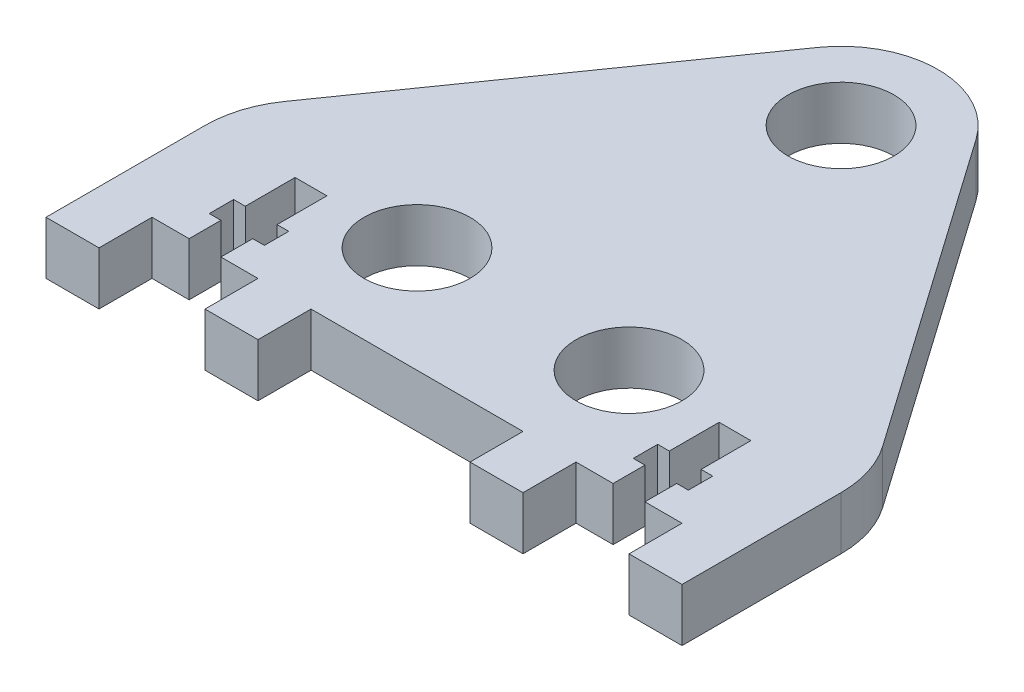
from build123d import *

# Parameters (mm, degrees)
SKETCH1_R           = 5
BOSS_EXTRUDE1_DEPTH = 5


with BuildPart() as part:
    # Sketch1 → Boss-Extrude1 (new body)
    with BuildSketch(Plane(origin=(0, 0, 0), x_dir=(1, 0, 0), z_dir=(0, 1, 0))):
        with BuildLine():
            Line((-27.687127114, -1.349796958), (-27.687127114, -16.349796958))
            Line((-27.687127114, -16.349796958), (-22.687127114, -16.349796958))
            Line((-22.687127114, -16.349796958), (-22.687127114, -11.349796958))
            Line((-22.687127114, -11.349796958), (-19.187127114, -11.349796958))
            Line((-19.187127114, -11.349796958), (-19.187127114, -8.349796958))
            Line((-19.187127114, -8.349796958), (-20.287127114, -8.349796958))
            Line((-20.287127114, -8.349796958), (-20.287127114, -6.049796958))
            Line((-20.287127114, -6.049796958), (-19.187127114, -6.049796958))
            Line((-19.187127114, -6.049796958), (-19.187127114, -1.349796958))
            Line((-19.187127114, -1.349796958), (-16.187127114, -1.349796958))
            Line((-16.187127114, -1.349796958), (-16.187127114, -6.049796958))
            Line((-16.187127114, -6.049796958), (-15.087127114, -6.049796958))
            Line((-15.087127114, -6.049796958), (-15.087127114, -8.349796958))
            Line((-15.087127114, -8.349796958), (-16.187127114, -8.349796958))
            Line((-16.187127114, -8.349796958), (-16.187127114, -11.349796958))
            Line((-16.187127114, -11.349796958), (-12.687127114, -11.349796958))
            Line((-12.687127114, -11.349796958), (-12.687127114, -16.349796958))
            Line((-12.687127114, -16.349796958), (-7.687127114, -16.349796958))
            Line((-7.687127114, -16.349796958), (-7.687127114, -11.349796958))
            Line((-7.687127114, -11.349796958), (12.312872886, -11.349796958))
            Line((12.312872886, -11.349796958), (12.312872886, -16.349796958))
            Line((12.312872886, -16.349796958), (17.312872886, -16.349796958))
            Line((17.312872886, -16.349796958), (17.312872886, -11.349796958))
            Line((17.312872886, -11.349796958), (20.812872886, -11.349796958))
            Line((20.812872886, -11.349796958), (20.812872886, -8.349796958))
            Line((20.812872886, -8.349796958), (19.712872886, -8.349796958))
            Line((19.712872886, -8.349796958), (19.712872886, -6.049796958))
            Line((19.712872886, -6.049796958), (20.812872886, -6.049796958))
            Line((20.812872886, -6.049796958), (20.812872886, -1.349796958))
            Line((20.812872886, -1.349796958), (23.812872886, -1.349796958))
            Line((23.812872886, -1.349796958), (23.812872886, -6.049796958))
            Line((23.812872886, -6.049796958), (24.912872886, -6.049796958))
            Line((24.912872886, -6.049796958), (24.912872886, -8.349796958))
            Line((24.912872886, -8.349796958), (23.812872886, -8.349796958))
            Line((23.812872886, -8.349796958), (23.812872886, -11.349796958))
            Line((23.812872886, -11.349796958), (27.312872886, -11.349796958))
            Line((27.312872886, -11.349796958), (27.312872886, -16.349796958))
            Line((27.312872886, -16.349796958), (32.312872886, -16.349796958))
            Line((32.312872886, -16.349796958), (32.312872886, -1.349796958))
            ThreePointArc((32.312872886, -1.349796958), (31.848951144, 1.660719852), (30.500230594, 4.391907821))
            Line((30.500230594, 4.391907821), (9.803978577, 33.903633866))
            ThreePointArc((9.803978577, 33.903633866), (2.312872886, 37.79980412), (-5.178232804, 33.903633866))
            Line((-5.178232804, 33.903633866), (-25.874484821, 4.391907821))
            ThreePointArc((-25.874484821, 4.391907821), (-27.223205372, 1.660719852), (-27.687127114, -1.349796958))
        make_face()
        with Locations((2.312872886, 28.650203042)):
            Circle(SKETCH1_R, mode=Mode.SUBTRACT)
        with Locations((-7.687127114, -1.349796958)):
            Circle(SKETCH1_R, mode=Mode.SUBTRACT)
        with Locations((12.312872886, -1.349796958)):
            Circle(SKETCH1_R, mode=Mode.SUBTRACT)
    extrude(amount=BOSS_EXTRUDE1_DEPTH)


solid = part.part
